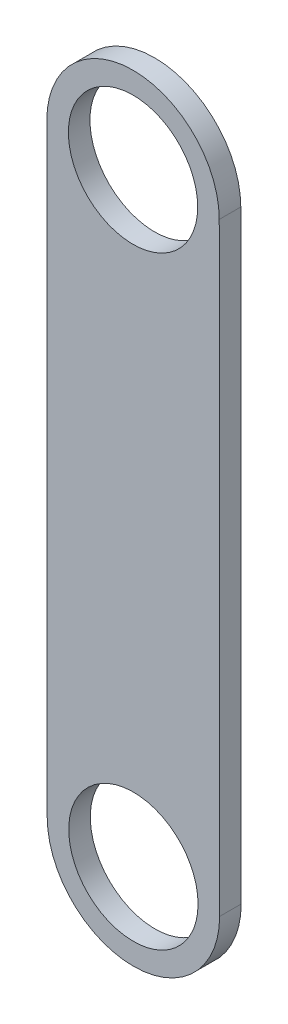
from build123d import *

# Parameters (mm, degrees)
ESQUISSE1_R               = 3
T_LE_DE_BASE_PLI_E1_DEPTH = 1


# Sheet-metal steps are written as plain solids
with BuildPart() as part:
    # Esquisse1 → Tôle de base pliée1 (new body)
    with BuildSketch(Plane.XY):
        with BuildLine():
            Line((-27.765102957, -5.867737456), (-27.7480158, -33.867732243))
            ThreePointArc((-27.7480158, -33.867732243), (-31.745574033, -37.87017252), (-35.748014311, -33.872614287))
            Line((-35.748014311, -33.872614287), (-35.765101467, -5.872619501))
            ThreePointArc((-35.765101467, -5.872619501), (-31.767543234, -1.870179223), (-27.765102957, -5.867737456))
        make_face()
        with Locations((-31.765102212, -5.870178479)):
            Circle(ESQUISSE1_R, mode=Mode.SUBTRACT)
        with Locations((-31.748015055, -33.870173265)):
            Circle(ESQUISSE1_R, mode=Mode.SUBTRACT)
    extrude(amount=-T_LE_DE_BASE_PLI_E1_DEPTH)


solid = part.part
